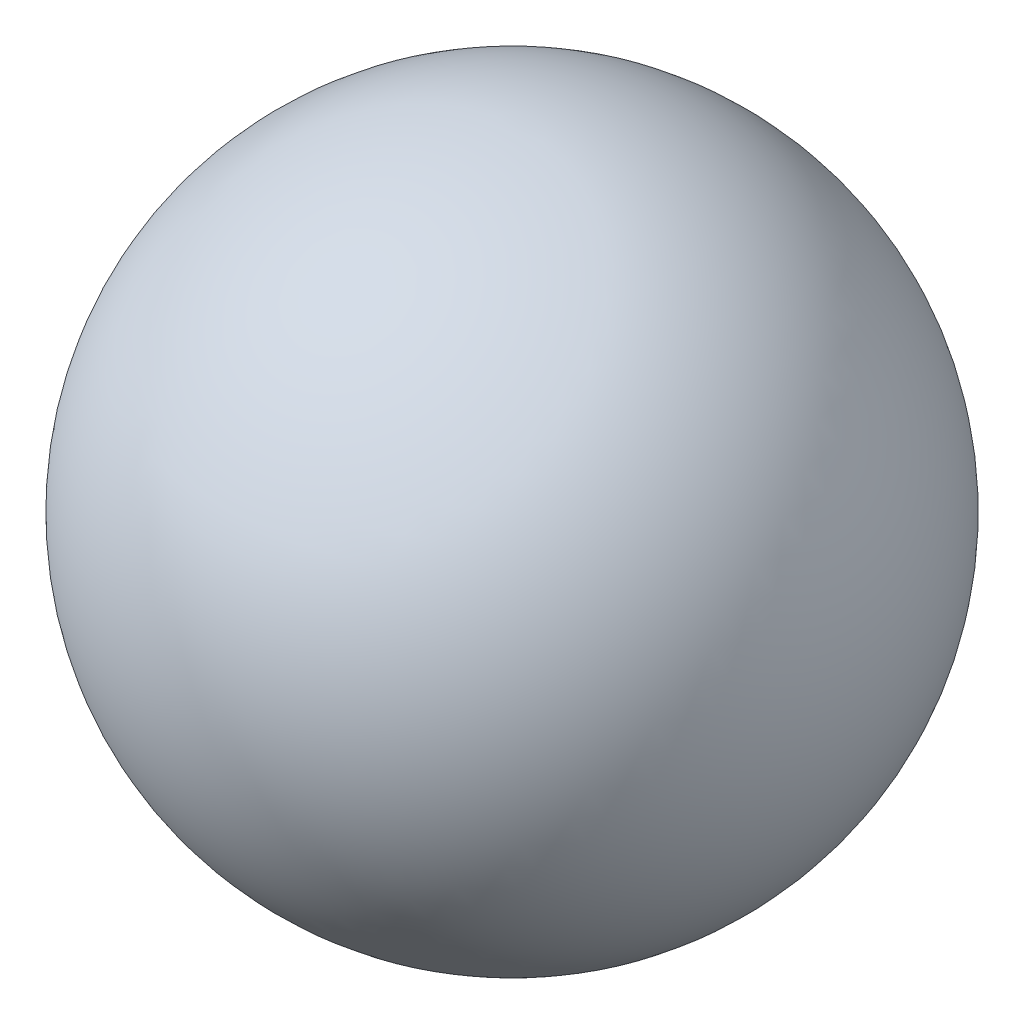
from build123d import *

# Parameters (mm, degrees)
BOSS_EXTRUDE1_DEPTH = 0.035


with BuildPart() as part:
    # Sketch2 → Boss-Extrude1 (new body)
    with BuildSketch(Plane.XY):
        with BuildLine():
            Line((177.15, -43.365), (177.15, -38.715))
            Line((177.15, -38.715), (178.55, -38.715))
            Line((178.55, -38.715), (178.55, -43.615))
            Line((178.55, -43.615), (179.45, -43.615))
            Line((179.45, -43.615), (179.45, -38.215))
            Line((179.45, -38.215), (174.45, -38.215))
            Line((174.45, -38.215), (174.45, -40.855))
            Line((174.45, -40.855), (172.45, -40.855))
            Line((172.45, -40.855), (172.45, -38.215))
            Line((172.45, -38.215), (169.75, -38.215))
            Line((169.75, -38.215), (169.75, -40.855))
            Line((169.75, -40.855), (167.75, -40.855))
            Line((167.75, -40.855), (167.75, -38.215))
            Line((167.75, -38.215), (165.05, -38.215))
            Line((165.05, -38.215), (165.05, -42.655))
            Line((165.05, -42.655), (165.55, -42.655))
            Line((165.55, -42.655), (165.55, -38.715))
            Line((165.55, -38.715), (167.25, -38.715))
            Line((167.25, -38.715), (167.25, -41.355))
            Line((167.25, -41.355), (170.25, -41.355))
            Line((170.25, -41.355), (170.25, -38.715))
            Line((170.25, -38.715), (171.95, -38.715))
            Line((171.95, -38.715), (171.95, -41.355))
            Line((171.95, -41.355), (174.95, -41.355))
            Line((174.95, -41.355), (174.95, -38.715))
            Line((174.95, -38.715), (176.65, -38.715))
            Line((176.65, -38.715), (176.65, -43.494121754))
            Line((176.65, -43.494121754), (176.65, -45.231483))
            ThreePointArc((176.65, -45.231483), (176.401357883, -46.087735796), (175.716135, -46.658228))
            Line((175.716135, -46.658228), (176.077028, -47.038824))
            ThreePointArc((176.077028, -47.038824), (176.835321007, -46.327629006), (177.15, -45.336779))
            Line((177.15, -45.336779), (177.15, -43.365))
        make_face()
    extrude(amount=BOSS_EXTRUDE1_DEPTH)


with BuildPart() as body_2:
    # Sketch4 → Revolve1 (revolve)
    with BuildSketch(Plane(origin=(0, 0, 0), x_dir=(-1, 0, 0), z_dir=(0, 0, -1))):
        with BuildLine():
            Line((-172.45, -31.226832332), (-172.45, -51.483167668))
            ThreePointArc((-172.45, -51.483167668), (-182.578167668, -41.355), (-172.45, -31.226832332))
        make_face()
    revolve(axis=Axis((172.45, -31.226832332, 0), (0, -1, 0)))


solid = Compound([part.part, body_2.part])
